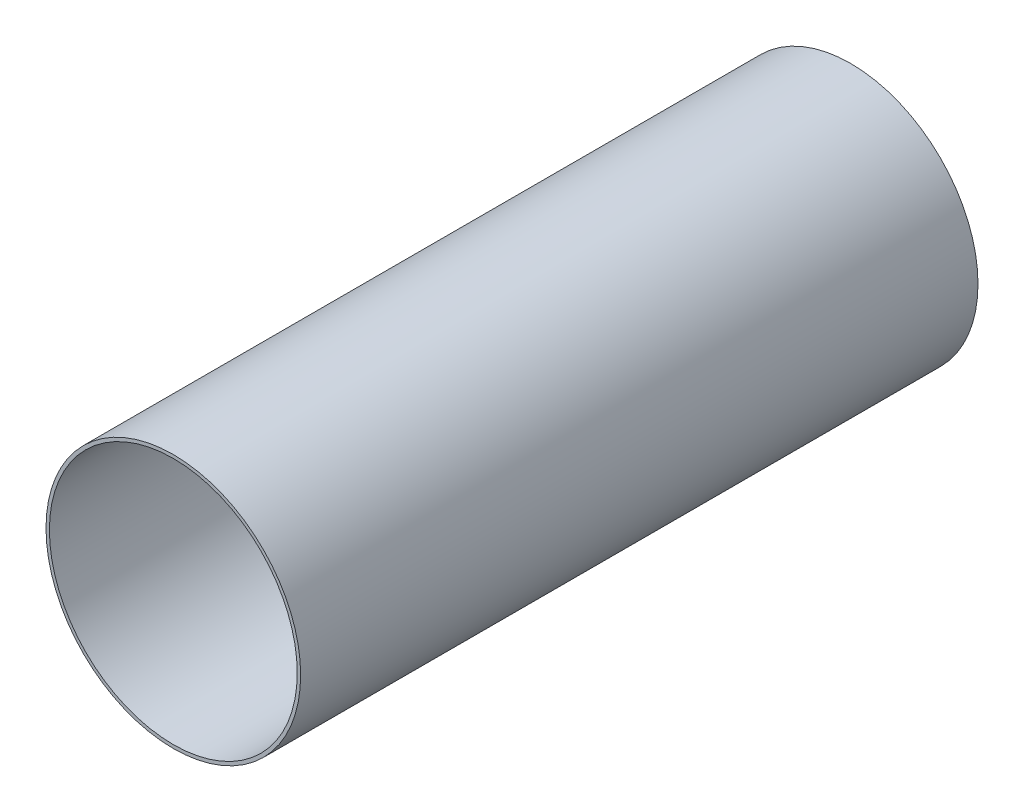
from build123d import *

# Parameters (mm, degrees)
SCHIZZO1_R                = 75
SCHIZZO1_R_2              = 73
ESTRUSIONE_SOTTILE1_DEPTH = 399


with BuildPart() as part:
    # Schizzo1 → Estrusione-Sottile1 (new body)
    with BuildSketch(Plane.XY):
        Circle(SCHIZZO1_R)
        Circle(SCHIZZO1_R_2, mode=Mode.SUBTRACT)
    extrude(amount=ESTRUSIONE_SOTTILE1_DEPTH)


solid = part.part
